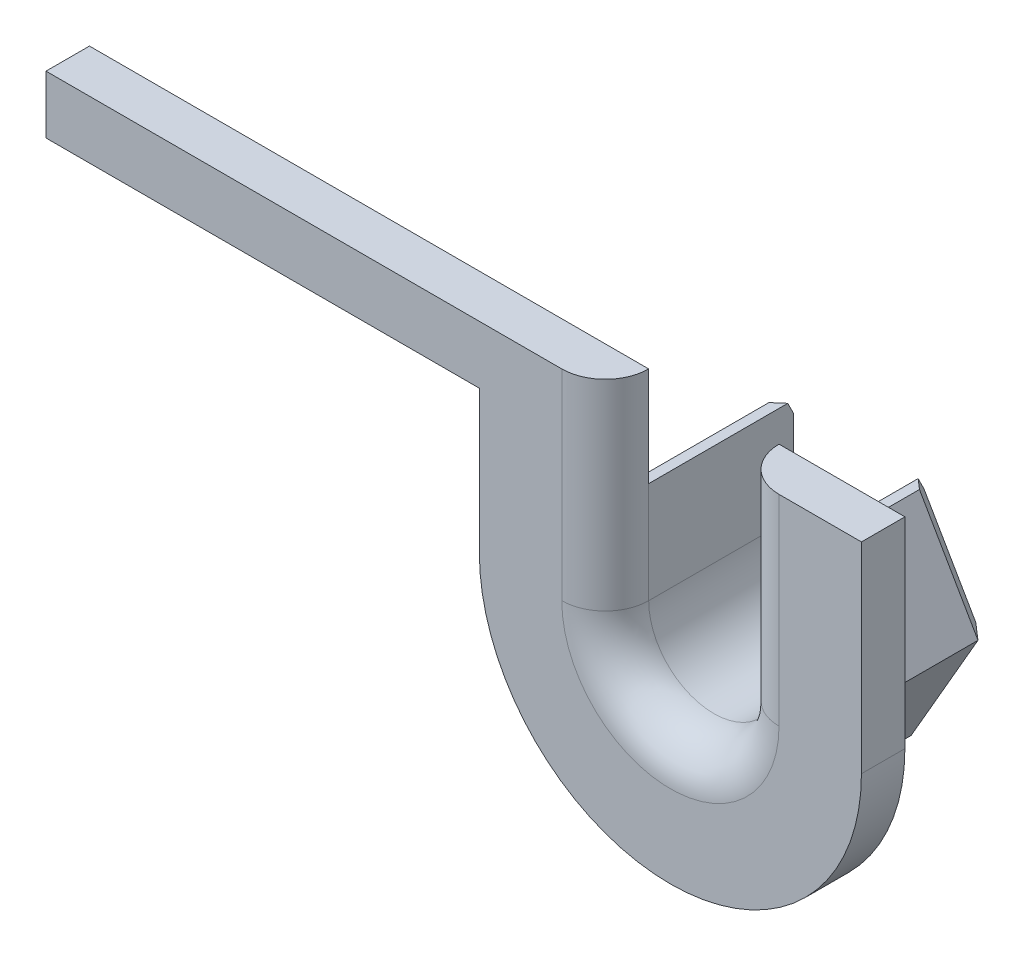
from build123d import *

# Parameters (mm, degrees)
BOSS_EXTRUDE1_DEPTH = 5
BOSS_EXTRUDE2_START = 1.5
BOSS_EXTRUDE2_DEPTH = 1.5
FILLET1_R           = 1.5
CHAMFER1_SIZE       = 0.5


with BuildPart() as part:
    # Sketch1 → Boss-Extrude1 (new body)
    with BuildSketch(Plane.XY):
        with BuildLine():
            Line((9.73, -20.68), (9.73, -24.18))
            ThreePointArc((9.73, -24.18), (7.48, -26.43), (5.23, -24.18))
            Line((5.23, -24.18), (5.23, -20.68))
            Line((5.23, -20.68), (4.881923789, -20.68))
            Line((4.881923789, -20.68), (2.861197846, -24.18))
            Line((2.861197846, -24.18), (5.170598923, -28.18))
            Line((5.170598923, -28.18), (9.789401077, -28.18))
            Line((9.789401077, -28.18), (12.098802154, -24.18))
            Line((12.098802154, -24.18), (10.078076211, -20.68))
            Line((10.078076211, -20.68), (9.73, -20.68))
        make_face()
    extrude(amount=-BOSS_EXTRUDE1_DEPTH)

    # Sketch2 → Boss-Extrude2 (add)
    with BuildSketch(Plane.XY.offset(BOSS_EXTRUDE2_START)):
        with BuildLine():
            ThreePointArc((9.73, -24.18), (7.48, -26.43), (5.23, -24.18))
            Line((5.23, -24.18), (5.23, -20.68))
            Line((5.23, -20.68), (5.23, -17.25))
            Line((5.23, -17.25), (-10.575, -17.25))
            Line((-10.575, -17.25), (-14.075, -17.25))
            Line((-14.075, -17.25), (-14.075, -19.25))
            Line((-14.075, -19.25), (0.885, -19.25))
            Line((0.885, -19.25), (0.885, -24.18))
            ThreePointArc((0.885, -24.18), (7.48, -30.775), (14.075, -24.18))
            Line((14.075, -24.18), (14.075, -17.25))
            Line((14.075, -17.25), (10.575, -17.25))
            Line((10.575, -17.25), (9.73, -17.25))
            Line((9.73, -17.25), (9.73, -20.68))
            Line((9.73, -20.68), (9.73, -24.18))
        make_face()
    extrude(amount=-BOSS_EXTRUDE2_DEPTH)

    # Fillet1
    fillet1_edges = [part.edges().sort_by_distance(p)[0] for p in [
        (9.73, -20.715, 1.5),
        (5.23, -20.715, 1.5),
        (7.48, -26.43, 1.5),
    ]]
    fillet(fillet1_edges, radius=FILLET1_R)

    # Chamfer1
    chamfer1_edges = [part.edges().sort_by_distance(p)[0] for p in [
        (3.871560818, -22.43, -5),
        (4.015898385, -26.18, -5),
        (7.48, -28.18, -5),
        (10.944101615, -26.18, -5),
        (11.088439182, -22.43, -5),
    ]]
    chamfer(chamfer1_edges, length=CHAMFER1_SIZE)


solid = part.part
